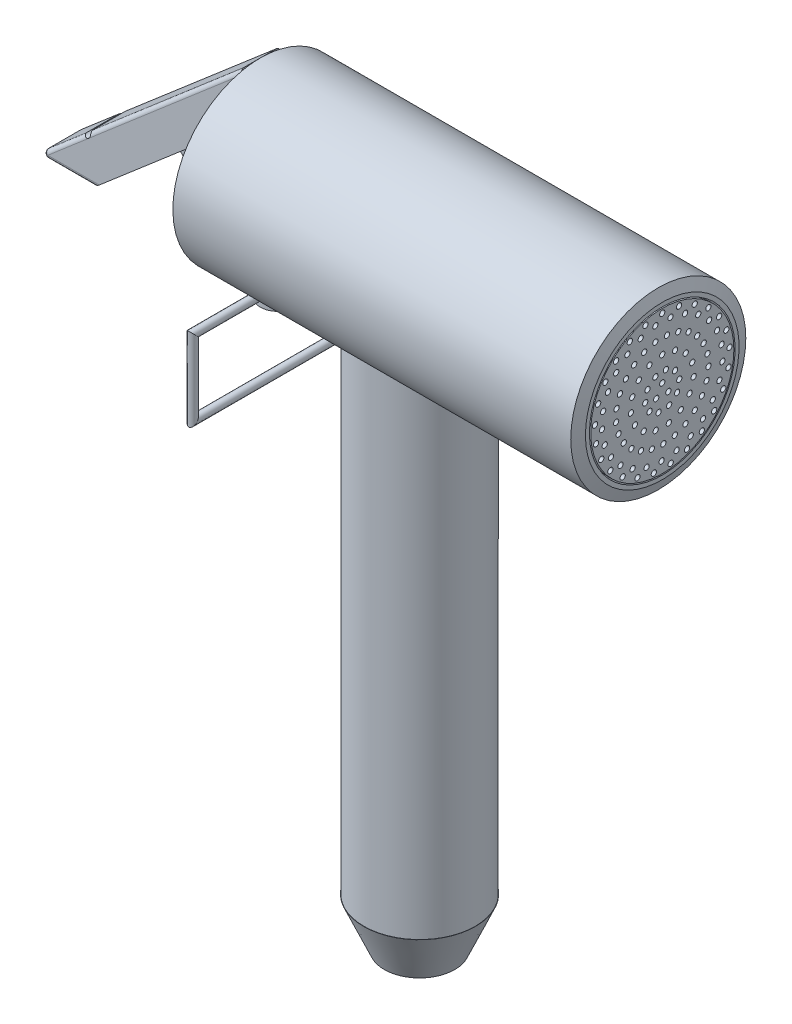
from build123d import *

# Parameters (mm, degrees)
SKETCH3_R                = 7
SKETCH3_R_2              = 5.000000000000002
BOSS_EXTRUDE1_DEPTH      = 70
BOSS_EXTRUDE2_DEPTH      = 30
BOSS_EXTRUDE2_DEPTH_BACK = 20
SKETCH5_R                = 10.999999999999995
SKETCH5_R_2              = 8.999999999999998
SKETCH6_R                = 8.999999999999995
CUT_EXTRUDE1_DEPTH       = 96.82275318733019
BOSS_EXTRUDE3_START      = -1
SKETCH7_R                = 8.999999999999991
BOSS_EXTRUDE3_DEPTH      = 1
CUT_EXTRUDE2_REACH       = 94.682
CUT_EXTRUDE2_END_RADIUS  = 8.999999999999998
SKETCH8_R                = 3.395470912589481
BOSS_EXTRUDE4_DEPTH      = 2.5
BOSS_EXTRUDE4_DEPTH_BACK = 2.5
BOSS_EXTRUDE5_DEPTH      = 1
BOSS_EXTRUDE5_DEPTH_BACK = 1
FILLET2_R                = 0.5
FILLET3_R                = 0.5
SKETCH24_R               = 8.999999999999995
BOSS_EXTRUDE10_DEPTH     = 1
SKETCH25_R               = 0.3299999999999999
SKETCH25_R_2             = 0.32999999999999996
SKETCH25_R_3             = 0.3299999999999995
SKETCH25_R_4             = 0.3300000000000004
SKETCH25_R_5             = 0.32999999999960666
SKETCH25_R_6             = 0.33000000000008517
SKETCH25_R_7             = 0.3300000000001811
SKETCH25_R_8             = 0.3300000000003137
SKETCH25_R_9             = 0.33000000000037205
SKETCH25_R_10            = 0.3300000000004528
SKETCH25_R_11            = 0.33000000000052504
SKETCH25_R_12            = 0.33000000000055
SKETCH25_R_13            = 0.3300000000005565
SKETCH25_R_14            = 0.3300000000005562
SKETCH25_R_15            = 0.3300000000005099
SKETCH25_R_16            = 0.3300000000004646
SKETCH25_R_17            = 0.3300000000004255
SKETCH25_R_18            = 0.33000000000032714
SKETCH25_R_19            = 0.330000000000233
SKETCH25_R_20            = 0.33000000000013024
SKETCH25_R_21            = 0.3300000000000568
SKETCH25_R_22            = 0.32999999999995455
SKETCH25_R_23            = 0.329999999999933
SKETCH25_R_24            = 0.3299999999998874
SKETCH25_R_25            = 0.329999999999865
SKETCH25_R_26            = 0.32999999999986435
SKETCH25_R_27            = 0.3299999999999003
SKETCH25_R_28            = 0.32999999999994567
SKETCH25_R_29            = 0.33000000000000723
SKETCH25_R_30            = 0.32999999999999935
SKETCH25_R_31            = 0.329999999999998
SKETCH25_R_32            = 0.3300000000000051
SKETCH25_R_33            = 0.3299999999999964
SKETCH25_R_34            = 0.3299999999999954
SKETCH25_R_35            = 0.3300000000000088
SKETCH25_R_36            = 0.3299999999999925
SKETCH25_R_37            = 0.3300000000000077
SKETCH25_R_38            = 0.32999999999999907
SKETCH25_R_39            = 0.3299999999999936
SKETCH25_R_40            = 0.3299999999999974
SKETCH25_R_41            = 0.33000000000000096
SKETCH25_R_42            = 0.3299999999999996
SKETCH25_R_43            = 0.3299999999999994
SKETCH25_R_44            = 0.3299999999999965
SKETCH25_R_45            = 0.3299999999999955
SKETCH25_R_46            = 0.33000000000000895
SKETCH25_R_47            = 0.329999999999985
SKETCH25_R_48            = 0.33000000000000496
SKETCH25_R_49            = 0.33000000000000124
SKETCH25_R_50            = 0.32999999999999086
SKETCH25_R_51            = 0.3300000000000032
SKETCH25_R_52            = 0.3300000000000016
SKETCH25_R_53            = 0.3300000000000558
SKETCH25_R_54            = 0.3300000000001081
SKETCH25_R_55            = 0.33000000000014695
SKETCH25_R_56            = 0.3300000000001998
SKETCH25_R_57            = 0.33000000000021384
SKETCH25_R_58            = 0.330000000000173
SKETCH25_R_59            = 0.33000000000012975
SKETCH25_R_60            = 0.330000000000106
SKETCH25_R_61            = 0.3300000000000461
SKETCH25_R_62            = 0.33000000000001006
SKETCH25_R_63            = 0.32999999999999735
SKETCH25_R_64            = 0.32999999999996643
SKETCH25_R_65            = 0.329999999999975
SKETCH25_R_66            = 0.3300000000000255
SKETCH25_R_67            = 0.3300000000000348
SKETCH25_R_68            = 0.3300000000000574
SKETCH25_R_69            = 0.3300000000000642
SKETCH25_R_70            = 0.3299999999999932
SKETCH25_R_71            = 0.32999999999996543
SKETCH25_R_72            = 0.3299999999999428
SKETCH25_R_73            = 0.32999999999993773
SKETCH25_R_74            = 0.3299999999999548
SKETCH25_R_75            = 0.32999999999999763
SKETCH25_R_76            = 0.32999999999998314
SKETCH25_R_77            = 0.3299999999999937
CUT_EXTRUDE5_DEPTH       = 1
SKETCH30_R               = 2.136708415465044
BOSS_EXTRUDE11_DEPTH     = 3
SKETCH31_R               = 0.49999999999999917
CUT_EXTRUDE6_START       = -5.000002
CUT_EXTRUDE6_DEPTH       = 5.000004000000001


with BuildPart() as part:
    # Sketch3 → Boss-Extrude1 (new body)
    with BuildSketch(Plane(origin=(0, 0, 0), x_dir=(1, 0, 0), z_dir=(0, 1, 0))):
        with Locations(Location((0, 0, 0), (0, 0, 270))):
            Circle(SKETCH3_R)
        with Locations(Location((0, 0, 0), (0, 0, 270))):
            Circle(SKETCH3_R_2, mode=Mode.SUBTRACT)
    extrude(amount=BOSS_EXTRUDE1_DEPTH)

    # Sketch4 → Revolve1 (revolve)
    with BuildSketch(Plane(origin=(0, 0, 0), x_dir=(0, 0, -1), z_dir=(1, 0, 0)), mode=Mode.PRIVATE) as revolve1_sk:
        Polygon((3.395470912589481, -6), (4.431171689803688, -6), (7.03433510597105, 0), (4.94718037578124, 0), (3.3954709125894804, -3.5765164496887607), align=None)
    revolve(revolve1_sk.sketch.rotate(Axis((0, 8.758532424818169, 0), (0, -1, 0)), 180), axis=Axis((0, 8.758532424818169, 0), (0, -1, 0)))

    # Sketch5 → Boss-Extrude2 (add, two sides: drawn at the far end of the back side and taken through both)
    with BuildSketch(Plane(origin=(0, 0, 0), x_dir=(0, 0, -1), z_dir=(1, 0, 0)).offset(-BOSS_EXTRUDE2_DEPTH_BACK)):
        with Locations((5.2e-15, 70)):
            Circle(SKETCH5_R)
        with Locations((5.2e-15, 70)):
            Circle(SKETCH5_R_2, mode=Mode.SUBTRACT)
    extrude(amount=BOSS_EXTRUDE2_DEPTH + BOSS_EXTRUDE2_DEPTH_BACK)

    # Sketch6 → Cut-Extrude1 (cut, through all)
    with BuildSketch(Plane(origin=(30, 0, 0), x_dir=(0, 0, -1), z_dir=(1, 0, 0))):
        with Locations((5.2e-15, 70)):
            Circle(SKETCH6_R)
    extrude(amount=-CUT_EXTRUDE1_DEPTH, mode=Mode.SUBTRACT)

    # Sketch7 → Boss-Extrude3 (add)
    with BuildSketch(Plane.ZY.offset(20).offset(BOSS_EXTRUDE3_START)):
        with Locations(Location((-5.2e-15, 70, 0), (0, 0, 180))):
            Circle(SKETCH7_R)
    extrude(amount=BOSS_EXTRUDE3_DEPTH)

    # Cut-Extrude2: up to this cylinder (the profile starts outside it)
    cut_extrude2_end = Plane(origin=(0, 70, -5.2e-15), z_dir=(1, 0, 0)) * Cylinder(CUT_EXTRUDE2_END_RADIUS, 208.364, mode=Mode.PRIVATE)
    # Sketch8 → Cut-Extrude2 (cut, up to the surface)
    with BuildSketch(Plane.XZ.offset(6), mode=Mode.PRIVATE) as cut_extrude2_sk1:
        with Locations(Location((0, 0, 0), (0, 0, 90))):
            Circle(SKETCH8_R)
    cut_extrude2_tool1 = extrude(cut_extrude2_sk1.sketch, amount=-CUT_EXTRUDE2_REACH, mode=Mode.PRIVATE) - cut_extrude2_end
    add(cut_extrude2_tool1.solids().sort_by_distance((0, -6, 0))[0], mode=Mode.SUBTRACT)

    # Sketch9 → Revolve2 (revolve)
    with BuildSketch(Plane.XY, mode=Mode.PRIVATE) as revolve2_sk:
        Polygon((30.000000000000004, 81), (30.5, 79.65628840214217), (30.5, 79.15628840214215), (30, 80.5), align=None)
    revolve(revolve2_sk.sketch.rotate(Axis((30, 70, 0), (1, 0, 0)), 270), axis=Axis((30, 70, 0), (1, 0, 0)))

    # Sketch10 → Boss-Extrude4 (add, two sides: drawn at the far end of the back side and taken through both)
    with BuildSketch(Plane.XY.offset(-BOSS_EXTRUDE4_DEPTH_BACK)):
        Polygon((-20, 81), (-45.564286230354206, 59.048443096280764), (-38.32390744113225, 59.048443096280764), (-20, 74.78282712202737), align=None)
    extrude(amount=BOSS_EXTRUDE4_DEPTH + BOSS_EXTRUDE4_DEPTH_BACK)

    # Sketch11 → Boss-Extrude5 (add, two sides: drawn at the far end of the back side and taken through both)
    with BuildSketch(Plane.XY.offset(-BOSS_EXTRUDE5_DEPTH_BACK)):
        with BuildLine():
            Line((-20, 63.13946361464154), (-20, 68.4443034833008))
            ThreePointArc((-20, 68.4443034833008), (-22.357183977167182, 69.4309622354852), (-24.301166554031457, 71.0894988001481))
            Line((-24.301166554031457, 71.0894988001481), (-29.16195372056612, 66.91563510915408))
            ThreePointArc((-29.16195372056612, 66.91563510915408), (-25.025132154371086, 63.94991550573095), (-20, 63.13946361464154))
        make_face()
    extrude(amount=BOSS_EXTRUDE5_DEPTH + BOSS_EXTRUDE5_DEPTH_BACK)

    # Fillet2
    fillet2_edges = [part.edges().sort_by_distance(p)[0] for p in [
        (-45.564286230354206, 59.048443096280764, 0),
    ]]
    fillet(fillet2_edges, radius=FILLET2_R)

    # Fillet3
    # the kernel refuses this fillet: 0.5 mm, written as the material it takes off along each edge
    with BuildSketch(Plane(origin=(-19.051650204955227, 81.8143295808446, -2.5), x_dir=(0.6514636646756805, -0.7586798360358159, 0), z_dir=(-0.7586798360358159, -0.6514636646756806, 0))) as fillet3_piece_1_section:
        with BuildLine():
            CenterArc((FILLET3_R, FILLET3_R), FILLET3_R, 180, 90)
            Line((0, FILLET3_R), (0, 0))
            Line((0, 0), (FILLET3_R, 0))
        make_face()
    fillet3_piece_1 = extrude(amount=33.59595899710195, mode=Mode.PRIVATE)
    fillet3_piece_1 = split(fillet3_piece_1, bisect_by=Plane(origin=(-20, 80.83554184803057, -2.360821221228834), z_dir=(-1, 0, 0)), keep=Keep.TOP, mode=Mode.PRIVATE)
    add(fillet3_piece_1, mode=Mode.SUBTRACT)
    with BuildSketch(Plane(origin=(-19.051650204955227, 81.8143295808446, 2.5), x_dir=(0.6514636646756805, -0.7586798360358159, 0), z_dir=(-0.7586798360358159, -0.6514636646756806, 0))) as fillet3_piece_2_section:
        with BuildLine():
            CenterArc((FILLET3_R, -FILLET3_R), FILLET3_R, 90, 90)
            Line((0, -FILLET3_R), (0, 0))
            Line((0, 0), (FILLET3_R, 0))
        make_face()
    fillet3_piece_2 = extrude(amount=33.59595899710195, mode=Mode.PRIVATE)
    fillet3_piece_2 = split(fillet3_piece_2, bisect_by=Plane(origin=(-20, 80.83554186211525, 2.360821171535076), z_dir=(-1, 0, 0)), keep=Keep.TOP, mode=Mode.PRIVATE)
    add(fillet3_piece_2, mode=Mode.SUBTRACT)
    with BuildSketch(Plane(origin=(-44.2144950360047, 59.048443096280764, 2.5), x_dir=(0, 1, 0), z_dir=(1, 0, 0))) as fillet3_piece_3:
        with BuildLine():
            CenterArc((FILLET3_R, -FILLET3_R), FILLET3_R, 90, 90)
            Line((0, -FILLET3_R), (0, 0))
            Line((0, 0), (FILLET3_R, 0))
        make_face()
    extrude(amount=7.14058759487245, mode=Mode.SUBTRACT)
    with BuildSketch(Plane(origin=(-44.2144950360047, 59.54844309628076, 2.5), x_dir=(-0.6514636646756727, 0.7586798360358228, 0), z_dir=(0.7586798360358228, 0.6514636646756727, 0))) as fillet3_piece_4:
        with BuildLine():
            CenterArc((0.5000000000000012 - FILLET3_R, -FILLET3_R), FILLET3_R, 0, 90)
            Line((0.5000000000000012, -FILLET3_R), (0.5000000000000012, 0))
            Line((0.5000000000000012, 0), (0.5000000000000012 - FILLET3_R, 0))
        make_face()
    revolve(axis=Axis((-44.2144950360047, 59.54844309628076, 2.5), (0, 0, 1)), revolution_arc=139.34795297037655, mode=Mode.SUBTRACT)
    with BuildSketch(Plane(origin=(-44.2144950360047, 59.048443096280764, -2.5), x_dir=(0, 1, 0), z_dir=(1, 0, 0))) as fillet3_piece_5:
        with BuildLine():
            CenterArc((FILLET3_R, FILLET3_R), FILLET3_R, 180, 90)
            Line((0, FILLET3_R), (0, 0))
            Line((0, 0), (FILLET3_R, 0))
        make_face()
    extrude(amount=7.14058759487245, mode=Mode.SUBTRACT)
    with BuildSketch(Plane(origin=(-44.2144950360047, 59.54844309628076, -2.5), x_dir=(-0.6514636646756727, 0.7586798360358228, 0), z_dir=(0.7586798360358228, 0.6514636646756727, 0))) as fillet3_piece_6:
        with BuildLine():
            CenterArc((0.5000000000000012 - FILLET3_R, FILLET3_R), FILLET3_R, 270, 90)
            Line((0.5000000000000012, FILLET3_R), (0.5000000000000012, 0))
            Line((0.5000000000000012, 0), (0.5000000000000012 - FILLET3_R, 0))
        make_face()
    revolve(axis=Axis((-44.2144950360047, 59.54844309628076, -2.5), (0, 0, 1)), revolution_arc=139.34795297037655, mode=Mode.SUBTRACT)

    # Sketch24 → Boss-Extrude10 (add)
    with BuildSketch(Plane(origin=(30.5, 0, 0), x_dir=(0, 0, -1), z_dir=(1, 0, 0))):
        with Locations((5.2e-15, 70)):
            Circle(SKETCH24_R)
    extrude(amount=-BOSS_EXTRUDE10_DEPTH)

    # Sketch25 → Cut-Extrude5 (cut)
    with BuildSketch(Plane(origin=(30.5, 0, 0), x_dir=(0, 0, -1), z_dir=(1, 0, 0))):
        with Locations((5.2e-15, 78.46690693206105)):
            Circle(SKETCH25_R)
        with Locations((2.1056341295696037, 78.2009034812377)):
            Circle(SKETCH25_R_2)
        with Locations((4.078963522797754, 77.41960710387497)):
            Circle(SKETCH25_R_3)
        with Locations((5.795996636510058, 76.17210952476961)):
            Circle(SKETCH25_R_3)
        with Locations((7.148845965365893, 74.536795604792)):
            Circle(SKETCH25_R_3)
        with Locations((8.052507010601506, 72.61641813179824)):
            Circle(SKETCH25_R_4)
        with Locations((8.450199425311888, 70.5316414850708)):
            Circle(SKETCH25_R_4)
        with Locations((8.316934732470374, 68.41345984859574)):
            Circle(SKETCH25_R_4)
        with Locations((7.661086442841414, 66.39496636471995)):
            Circle(SKETCH25_R_4)
        with Locations((6.523863916503739, 64.60299040253506)):
            Circle(SKETCH25_R_3)
        with Locations((4.976723027199002, 63.15012840217175)):
            Circle(SKETCH25_R_3)
        with Locations((3.116876326988427, 62.12766902636553)):
            Circle(SKETCH25_R_2)
        with Locations((1.0611848240840402, 61.59985715804169)):
            Circle(SKETCH25_R_5)
        with Locations((-1.0611848240825745, 61.599857158040756)):
            Circle(SKETCH25_R_2)
        with Locations((-3.116876326987126, 62.12766902636531)):
            Circle(SKETCH25_R_2)
        with Locations((-4.976723027197809, 63.15012840217139)):
            Circle(SKETCH25_R_3)
        with Locations((-6.523863916502629, 64.60299040253459)):
            Circle(SKETCH25_R_3)
        with Locations((-7.661086442840428, 66.39496636471941)):
            Circle(SKETCH25_R_3)
        with Locations((-8.316934732469514, 68.41345984859515)):
            Circle(SKETCH25_R_4)
        with Locations((-8.450199425311208, 70.5316414850702)):
            Circle(SKETCH25_R_4)
        with Locations((-8.052507010601007, 72.61641813179767)):
            Circle(SKETCH25_R_3)
        with Locations((-7.148845965365524, 74.53679560479151)):
            Circle(SKETCH25_R_3)
        with Locations((-5.795996636509759, 76.17210952476921)):
            Circle(SKETCH25_R_3)
        with Locations((-4.078963522797532, 77.41960710387467)):
            Circle(SKETCH25_R_2)
        with Locations((-2.1056341295694647, 78.20090348123752)):
            Circle(SKETCH25_R_2)
        with Locations((-0.8660998137252459, 77.52641603938669)):
            Circle(SKETCH25_R_2)
        with Locations((1.0328538601598327, 77.5053501043473)):
            Circle(SKETCH25_R_6)
        with Locations((2.8669095274402805, 77.01269541950495)):
            Circle(SKETCH25_R_7)
        with Locations((4.520826725355977, 76.0794072905655)):
            Circle(SKETCH25_R_8)
        with Locations((5.89068375367994, 74.76412764306382)):
            Circle(SKETCH25_R_9)
        with Locations((6.890407457340789, 73.14950033451264)):
            Circle(SKETCH25_R_10)
        with Locations((7.457181519310945, 71.33697833689203)):
            Circle(SKETCH25_R_11)
        with Locations((7.555393440827657, 69.44044907330219)):
            Circle(SKETCH25_R_12)
        with Locations((7.178872205663806, 67.57907845232113)):
            Circle(SKETCH25_R_13)
        with Locations((6.351276027773013, 65.86982323570741)):
            Circle(SKETCH25_R_14)
        with Locations((5.124605818697958, 64.42008221492183)):
            Circle(SKETCH25_R_15)
        with Locations((3.575937779052292, 63.32094795007484)):
            Circle(SKETCH25_R_16)
        with Locations((1.8025804173695965, 62.641483089359895)):
            Circle(SKETCH25_R_17)
        with Locations((-0.08403970136345508, 62.42438090887255)):
            Circle(SKETCH25_R_18)
        with Locations((-1.9653792965834256, 62.683282737058896)):
            Circle(SKETCH25_R_19)
        with Locations((-3.7232268824396053, 63.401920819879635)):
            Circle(SKETCH25_R_20)
        with Locations((-5.247130430201465, 64.53514048362513)):
            Circle(SKETCH25_R_21)
        with Locations((-6.441337475437923, 66.01173736913191)):
            Circle(SKETCH25_R_22)
        with Locations((-7.230811597510452, 67.73893146354006)):
            Circle(SKETCH25_R_23)
        with Locations((-7.565947233846562, 69.60819680972243)):
            Circle(SKETCH25_R_24)
        with Locations((-7.425686579872587, 71.50208059130128)):
            Circle(SKETCH25_R_25)
        with Locations((-6.8188427283202895, 73.30158312506273)):
            Circle(SKETCH25_R_26)
        with Locations((-5.783545910198302, 74.89363504870315)):
            Circle(SKETCH25_R_27)
        with Locations((-4.384847632144563, 76.17820188470282)):
            Circle(SKETCH25_R_28)
        with Locations((-2.710633251021624, 77.07456957444951)):
            Circle(SKETCH25_R_29)
        with Locations((-0.8660998137252459, 75.75216026422385)):
            Circle(SKETCH25_R_2)
        with Locations((0.5916143916330739, 75.78683583698931)):
            Circle(SKETCH25_R_30)
        with Locations((2.012155288959573, 75.45790323162326)):
            Circle(SKETCH25_R_31)
        with Locations((3.306265069291228, 74.78603049345034)):
            Circle(SKETCH25_R_32)
        with Locations((4.392630055726994, 73.81343385758507)):
            Circle(SKETCH25_R_33)
        with Locations((5.202989940798153, 72.60122514761905)):
            Circle(SKETCH25_R_34)
        with Locations((5.6864268326305005, 71.22557189499123)):
            Circle(SKETCH25_R_35)
        with Locations((5.812564613353707, 69.77291145286293)):
            Circle(SKETCH25_R_36)
        with Locations((5.573477582302616, 68.33451981932457)):
            Circle(SKETCH25_R_37)
        with Locations((4.98418845693873, 67.00077643074567)):
            Circle(SKETCH25_R_38)
        with Locations((4.081724440262509, 65.85548528939569)):
            Circle(SKETCH25_R_39)
        with Locations((2.9227906654721894, 64.97060924977191)):
            Circle(SKETCH25_R_40)
        with Locations((1.5802072038981156, 64.40174832779027)):
            Circle(SKETCH25_R_41)
        with Locations((0.13833351210756212, 64.18464614730296)):
            Circle(SKETCH25_R_42)
        with Locations((-1.3122321830037613, 64.33294403675603)):
            Circle(SKETCH25_R_43)
        with Locations((-2.6803455040045816, 64.83732389435364)):
            Circle(SKETCH25_R_44)
        with Locations((-3.8800428593675567, 65.66609367866357)):
            Circle(SKETCH25_R_45)
        with Locations((-4.835942852077002, 66.76717873613556)):
            Circle(SKETCH25_R_46)
        with Locations((-5.487982770036787, 68.07139384310109)):
            Circle(SKETCH25_R_47)
        with Locations((-5.795192547166303, 69.49679036782187)):
            Circle(SKETCH25_R_48)
        with Locations((-5.738269063330067, 70.95380540440797)):
            Circle(SKETCH25_R_44)
        with Locations((-5.320789030367444, 72.35088933958423)):
            Circle(SKETCH25_R_49)
        with Locations((-4.56898425413356, 73.60025825158823)):
            Circle(SKETCH25_R_50)
        with Locations((-3.530093393663808, 74.62340969682123)):
            Circle(SKETCH25_R_51)
        with Locations((-2.269393782494824, 75.3560553070916)):
            Circle(SKETCH25_R_52)
        with Locations((5.2e-15, 73.96560918739156)):
            Circle(SKETCH25_R_2)
        with Locations((1.6129585686301557, 73.6227642599274)):
            Circle(SKETCH25_R_53)
        with Locations((2.9470219474756103, 72.6535104801417)):
            Circle(SKETCH25_R_54)
        with Locations((3.771518458748649, 71.22544063195365)):
            Circle(SKETCH25_R_55)
        with Locations((3.9438851653344997, 69.58548096572216)):
            Circle(SKETCH25_R_56)
        with Locations((3.4343182977621463, 68.01719540630452)):
            Circle(SKETCH25_R_57)
        with Locations((2.330926596704455, 66.79175477435112)):
            Circle(SKETCH25_R_58)
        with Locations((0.8244965112732505, 66.12104888790529)):
            Circle(SKETCH25_R_59)
        with Locations((-0.824496511272735, 66.12104888790525)):
            Circle(SKETCH25_R_60)
        with Locations((-2.3309265967039945, 66.79175477435095)):
            Circle(SKETCH25_R_61)
        with Locations((-3.4343182977617386, 68.01719540630431)):
            Circle(SKETCH25_R_62)
        with Locations((-3.9438851653342173, 69.58548096572189)):
            Circle(SKETCH25_R_63)
        with Locations((-3.77151845874846, 71.22544063195338)):
            Circle(SKETCH25_R_64)
        with Locations((-2.9470219474755046, 72.65351048014153)):
            Circle(SKETCH25_R_65)
        with Locations((-1.6129585686301289, 73.62276425992728)):
            Circle(SKETCH25_R_66)
        with Locations((-0.8660998137252459, 71.96815582826822)):
            Circle(SKETCH25_R_2)
        with Locations((0.45616350194080507, 72.10135221016809)):
            Circle(SKETCH25_R_67)
        with Locations((1.6041878642926395, 71.43190347011847)):
            Circle(SKETCH25_R_68)
        with Locations((2.139466986824793, 70.21551627309258)):
            Circle(SKETCH25_R_69)
        with Locations((1.8575424381982104, 68.91680918487405)):
            Circle(SKETCH25_R_70)
        with Locations((0.8660998137252798, 68.03184417173196)):
            Circle(SKETCH25_R_71)
        with Locations((-0.456163501940751, 67.89864778983208)):
            Circle(SKETCH25_R_72)
        with Locations((-1.6041878642925924, 68.5680965298817)):
            Circle(SKETCH25_R_73)
        with Locations((-2.1394669868247593, 69.7844837269076)):
            Circle(SKETCH25_R_74)
        with Locations((-1.8575424381981827, 71.08319081512614)):
            Circle(SKETCH25_R_75)
        with Locations((5.2e-15, 70.87706412688685)):
            Circle(SKETCH25_R_2)
        with Locations((0.7595598146320839, 69.5614679365566)):
            Circle(SKETCH25_R_76)
        with Locations((-0.7595598146319729, 69.56146793655657)):
            Circle(SKETCH25_R_77)
    extrude(amount=-CUT_EXTRUDE5_DEPTH, mode=Mode.SUBTRACT)

    # Sketch32 → Cut-Extrude6 (cut)
    with BuildSketch(Plane(origin=(0, 0, -2.5), x_dir=(-1, 0, 0), z_dir=(0, 0, -1)).offset(CUT_EXTRUDE6_START)):
        with BuildLine():
            Line((39.00834642511233, 64.67790148973467), (39.767026261148146, 64.02643782505898))
            ThreePointArc((39.767026261148146, 64.02643782505898), (39.06195451079239, 63.9728297393789), (39.00834642511233, 64.67790148973467))
        make_face()
    extrude(amount=CUT_EXTRUDE6_DEPTH, mode=Mode.SUBTRACT)


with BuildPart() as body_2:
    # Sketch30 → Boss-Extrude11 (new body)
    with BuildSketch(Plane(origin=(0, 59.000000000000014, 0), x_dir=(-1, 0, 0), z_dir=(0, -1, 0))):
        with Locations(Location((17.863291584534956, 0, 0), (0, 0, 90))):
            Circle(SKETCH30_R)
    extrude(amount=BOSS_EXTRUDE11_DEPTH)


with BuildPart() as body_3:
    # Sweep6: sweep along a curve in space
    with BuildLine() as sweep6_path:
        Line((-18.000000000000004, 57.50000000000001, -2.136708415465044), (-18.000000000000004, 57.50000000000001, -10.967998426501424))
        Line((-18.000000000000004, 57.50000000000001, -10.967998426501424), (-18.000000000000004, 47.81592004562896, -10.967998426501426))
        Line((-18.000000000000004, 47.81592004562896, -10.967998426501426), (-18.000000000000004, 47.81592004562896, 10.497027955363334))
        Line((-18.000000000000004, 47.81592004562896, 10.497027955363334), (-18.000000000000004, 57.248078876892095, 10.497027955363334))
        Line((-18.000000000000004, 57.248078876892095, 10.497027955363334), (-18.000000000000004, 57.248078876892095, 2.363248989212252))
    # Sketch31 → Sweep6 (sweep)
    with BuildSketch(Plane(origin=(0, 0, -2.136708415465044), x_dir=(-1, 0, 0), z_dir=(0, 0, -1))):
        with Locations((18.000000000000004, 57.50000000000001)):
            Circle(SKETCH31_R)
    sweep(path=sweep6_path.line, transition=Transition.RIGHT)


solid = Compound([part.part, body_2.part, body_3.part])
